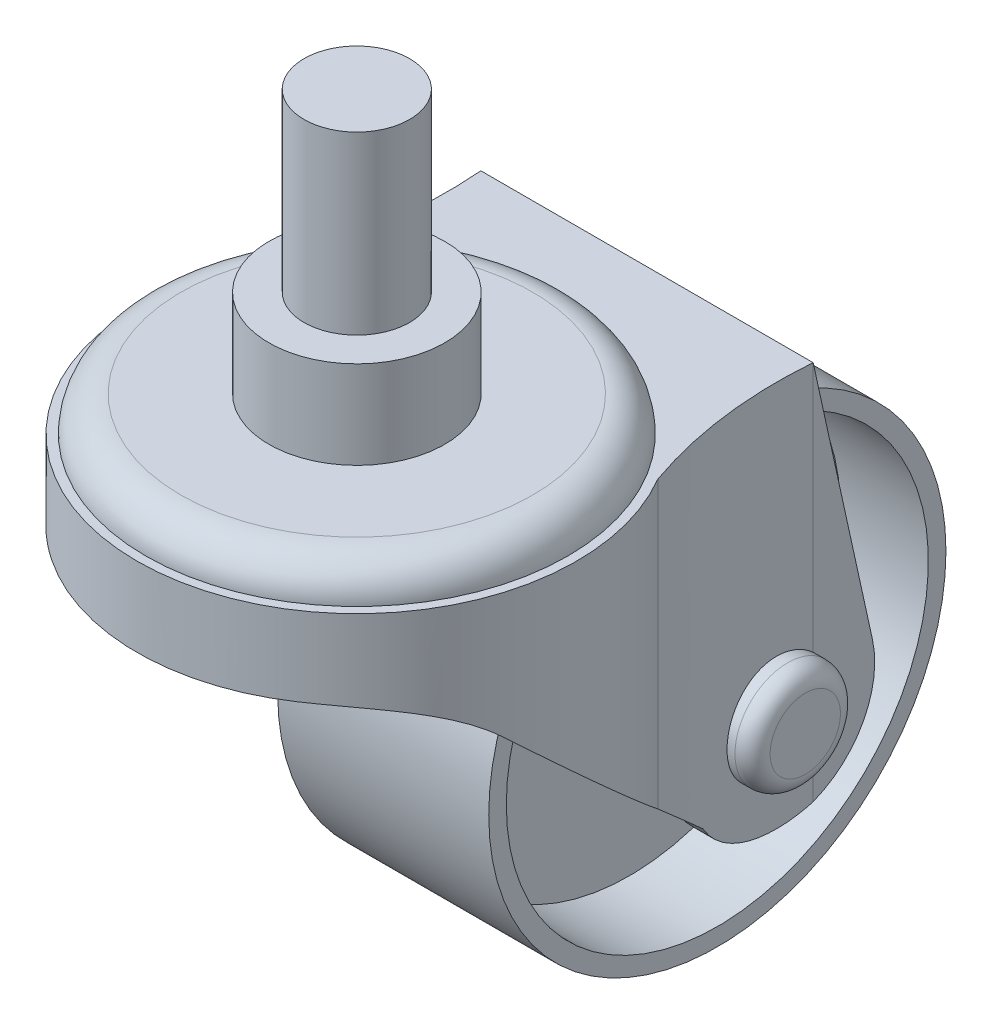
from build123d import *

# Parameters (mm, degrees)
BASE_DEPTH             = 25
ESQUISSE2_W            = 3.051401781
ESQUISSE2_H            = 3.671186171
VIDE_BASE_DEPTH        = 25
CONG_2_R               = 2
VIDE_BASE_2_DEPTH      = 14
VIDE_BASE_2_DEPTH_BACK = 14
AXE_ROUE_DEPTH         = 11
AXE_ROUE_DEPTH_BACK    = 11
ESQUISSE7_R            = 3
CONGE_VIS_1_R          = 1
CONGE_VIS_2_R          = 1


with BuildPart() as part:
    # Esquisse1 → BASE (new body)
    with BuildSketch(Plane(origin=(0, 0, 0), x_dir=(0, 0, -1), z_dir=(1, 0, 0))):
        with BuildLine():
            Line((5.371432156, 1.182250648), (2, 16.5))
            Line((2, 16.5), (-27, 16.5))
            Line((-27, 16.5), (-27, 12))
            Line((-27, 12), (-24.881319015, 12))
            ThreePointArc((-24.881319015, 12), (-21.262987094, 11.322428552), (-18.134990853, 9.381534822))
            Line((-18.134990853, 9.381534822), (-4.641317523, -2.950961141))
            ThreePointArc((-4.641317523, -2.950961141), (2.098601145, -5.083883676), (5.371432156, 1.182250648))
        make_face()
    extrude(amount=BASE_DEPTH)

    # Esquisse2 → VIDE BASE (cut)
    with BuildSketch(Plane(origin=(0, 16.5, 0), x_dir=(1, 0, 0), z_dir=(0, 1, 0))):
        with BuildLine():
            Line((25, 2), (21.948598219, 2))
            add(Edge.make_bspline(
                [(23.267838517, -8.151484137), (21.529216313, -3.190142242), (21.948598219, 2)],
                knots=[0, 0, 0, 1, 1, 1], degree=2))
            ThreePointArc((23.267838517, -8.151484137), (24.559186985, -11.209709851), (25, -14.5))
            Line((25, -14.5), (25, 2))
        make_face()
        with Locations((23.47429911, 3.835593086)):
            Rectangle(ESQUISSE2_W, ESQUISSE2_H)
        with Locations((1.525700891, 3.835593086)):
            Rectangle(ESQUISSE2_W, ESQUISSE2_H)
        with BuildLine():
            add(Edge.make_bspline(
                [(1.732161483, -8.151484137), (3.470783687, -3.190142242), (3.051401781, 2)],
                knots=[0, 0, 0, 1, 1, 1], degree=2))
            Line((3.051401781, 2), (0, 2))
            Line((0, 2), (0, -14.49999997))
            ThreePointArc((0, -14.49999997), (0.440813019, -11.209709836), (1.732161483, -8.151484137))
        make_face()
        with BuildLine():
            Line((0, -27), (12.5, -27))
            ThreePointArc((12.5, -27), (3.661165225, -23.338834754), (0, -14.49999997))
            Line((0, -14.49999997), (0, -27))
        make_face()
        with BuildLine():
            Line((25, -27), (25, -14.5))
            ThreePointArc((25, -14.5), (21.338834765, -23.338834765), (12.5, -27))
            Line((12.5, -27), (25, -27))
        make_face()
    extrude(amount=-VIDE_BASE_DEPTH, mode=Mode.SUBTRACT)

    # Esquisse4 → VIS (revolve)
    with BuildSketch(Plane.ZY.offset(-12.5), mode=Mode.PRIVATE) as vis_sk:
        Polygon((14.5, 16.5), (14.5, 33.5), (17.5, 33.5), (17.5, 23.5), (19.5, 23.5), (19.5, 18.5), (26.5, 18.5), (26.5, 16.5), align=None)
    revolve(vis_sk.sketch.rotate(Axis((12.5, 16.5, 14.5), (0, 1, 0)), 180), axis=Axis((12.5, 16.5, 14.5), (0, 1, 0)))

    # Congé2
    cong_2_edges = [part.edges().sort_by_distance(p)[0] for p in [
        (12.5, 18.5, 26.5),
    ]]
    fillet(cong_2_edges, radius=CONG_2_R - 0.0001)  # a hair under: the kernel refuses the full size

    # Esquisse6 → VIDE BASE 2 (cut, two sides: drawn at the far end of the back side and taken through both)
    with BuildSketch(Plane(origin=(0, 0, 0), x_dir=(1, 0, 0), z_dir=(0, 1, 0)).offset(-VIDE_BASE_2_DEPTH_BACK)):
        with BuildLine():
            Line((4.051401781, 5.5), (4.051401781, -5.609523223))
            ThreePointArc((4.051401781, -5.609523223), (12.5, -25.384659014), (20.948598219, -5.609523223))
            Line((20.948598219, -5.609523223), (20.948598219, 5.5))
            Line((20.948598219, 5.5), (4.051401781, 5.5))
        make_face()
    extrude(amount=VIDE_BASE_2_DEPTH + VIDE_BASE_2_DEPTH_BACK, mode=Mode.SUBTRACT)

    # Esquisse7 → AXE ROUE (add, two sides: drawn at the far end of the back side and taken through both)
    with BuildSketch(Plane.ZY.offset(-12.5).offset(-AXE_ROUE_DEPTH_BACK)):
        Circle(ESQUISSE7_R)
    extrude(amount=AXE_ROUE_DEPTH + AXE_ROUE_DEPTH_BACK)

    # CONGE VIS 1
    conge_vis_1_edges = [part.edges().sort_by_distance(p)[0] for p in [
        (23.5, 0, -3),
    ]]
    fillet(conge_vis_1_edges, radius=CONGE_VIS_1_R)

    # CONGE VIS 2
    conge_vis_2_edges = [part.edges().sort_by_distance(p)[0] for p in [
        (1.5, 0, -3),
    ]]
    fillet(conge_vis_2_edges, radius=CONGE_VIS_2_R)

    # Esquisse9 → ROUE (revolve)
    with BuildSketch(Plane(origin=(0, 0, 0), x_dir=(1, 0, 0), z_dir=(0, 1, 0))):
        Polygon((18.5, -4), (18.5, -3), (6.5, -3), (6.5, -4), (11.5, -4), (11.5, -12), (6.5, -12), (6.5, -13), (18.5, -13), (18.5, -12), (13.5, -12), (13.5, -4), align=None)
    revolve(axis=Axis((7.793426375, 0, 0), (1, 0, 0)))


solid = part.part
